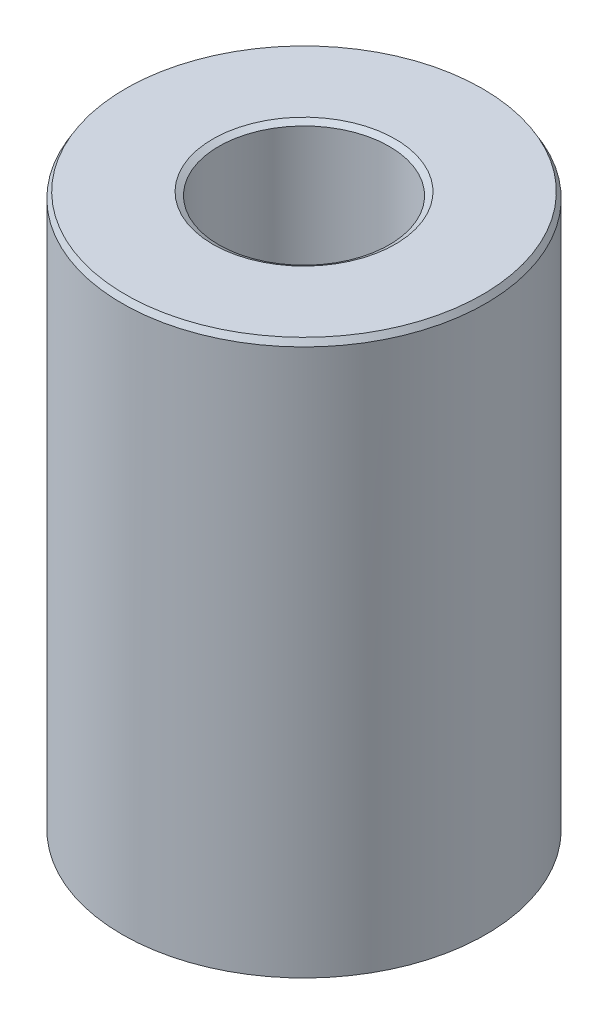
from build123d import *
from OCP.BRepFilletAPI import BRepFilletAPI_MakeChamfer

# Parameters (mm, degrees)
SKETCH1_R           = 35
BOSS_EXTRUDE1_DEPTH = 106.971525787
SKETCH2_R           = 16.413151297
CUT_EXTRUDE1_DEPTH  = 118.868177763
CHAMFER1_SIZE       = 1.141762208
CHAMFER1_SIZE2      = 0.659196718


with BuildPart() as part:
    # Sketch1 → Boss-Extrude1 (new body)
    with BuildSketch(Plane(origin=(0, 0, 0), x_dir=(1, 0, 0), z_dir=(0, 1, 0))):
        Circle(SKETCH1_R)
    extrude(amount=BOSS_EXTRUDE1_DEPTH)

    # Sketch2 → Cut-Extrude1 (cut, through all)
    with BuildSketch(Plane(origin=(0, 0, 0), x_dir=(1, 0, 0), z_dir=(0, 1, 0))):
        Circle(SKETCH2_R)
    extrude(amount=CUT_EXTRUDE1_DEPTH, mode=Mode.SUBTRACT)

    # Chamfer1: one chamfer whose edges measure the first distance from different faces: ONE call of the kernel's chamfer builder (chamfer() names one face for all edges)
    chamfer1_edges_1 = [part.edges().sort_by_distance(p)[0] for p in [
        (-16.413151297, 106.971525787, 0),
    ]]
    chamfer1_side_1 = [part.faces().sort_by_distance(p)[0] for p in [
        (-34.010050506, 106.971525787, 0),
    ]]
    chamfer1_edges_2 = [part.edges().sort_by_distance(p)[0] for p in [
        (-16.413151297, 0, 0),
    ]]
    chamfer1_side_2 = [part.faces().sort_by_distance(p)[0] for p in [
        (-16.413151297, 53.485762893, 0),
    ]]
    chamfer1_edges_3 = [part.edges().sort_by_distance(p)[0] for p in [
        (-35, 0, 0),
    ]]
    chamfer1_side_3 = [part.faces().sort_by_distance(p)[0] for p in [
        (-34.010050506, 0, 0),
    ]]
    chamfer1_edges_4 = [part.edges().sort_by_distance(p)[0] for p in [
        (-35, 106.971525787, 0),
    ]]
    chamfer1_side_4 = [part.faces().sort_by_distance(p)[0] for p in [
        (-35, 53.485762893, 0),
    ]]
    chamfer1 = BRepFilletAPI_MakeChamfer(part.part.solid().wrapped)
    for e in chamfer1_edges_1:
        chamfer1.Add(CHAMFER1_SIZE, CHAMFER1_SIZE2, e.wrapped, chamfer1_side_1[0].wrapped)  # the first distance lies on this face
    for e in chamfer1_edges_2:
        chamfer1.Add(CHAMFER1_SIZE, CHAMFER1_SIZE2, e.wrapped, chamfer1_side_2[0].wrapped)  # the first distance lies on this face
    for e in chamfer1_edges_3:
        chamfer1.Add(CHAMFER1_SIZE, CHAMFER1_SIZE2, e.wrapped, chamfer1_side_3[0].wrapped)  # the first distance lies on this face
    for e in chamfer1_edges_4:
        chamfer1.Add(CHAMFER1_SIZE, CHAMFER1_SIZE2, e.wrapped, chamfer1_side_4[0].wrapped)  # the first distance lies on this face
    add(Compound.cast(chamfer1.Shape()), mode=Mode.REPLACE)


solid = part.part
